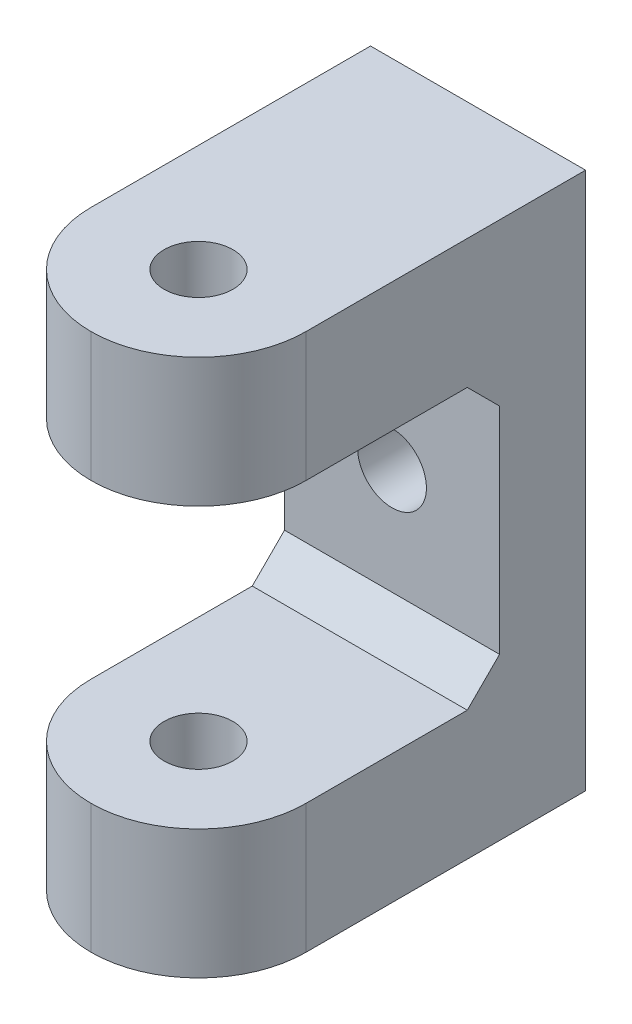
from build123d import *

# Parameters (mm, degrees)
SKETCH1_W                = 10
SKETCH1_H                = 6
BOSS_EXTRUDE1_DEPTH      = 15
BOSS_EXTRUDE1_2_DEPTH    = 15
FILLET1_R                = 5
FILLET2_R                = 5
BOSS_EXTRUDE2_DEPTH      = 3
BOSS_EXTRUDE2_DEPTH_BACK = 1
SKETCH2_W                = 10
SKETCH2_H                = 25
SKETCH3_R                = 1.6
CUT_EXTRUDE1_DEPTH       = 31.822070015
CUT_EXTRUDE2_REACH       = 34.388
SKETCH4_R                = 1.6
CHAMFER1_SIZE            = 1.5


with BuildPart() as part:
    # Sketch1 → Boss-Extrude1 (new body)
    with BuildSketch(Plane.XY):
        with Locations((5, 3)):
            Rectangle(SKETCH1_W, SKETCH1_H)
    extrude(amount=BOSS_EXTRUDE1_DEPTH)

    # Fillet2
    fillet2_edges = [part.edges().sort_by_distance(p)[0] for p in [
        (10, 3, 15),
        (0, 3, 15),
    ]]
    fillet(fillet2_edges, radius=FILLET2_R - 0.0001)  # a hair under: the kernel refuses the full size



with BuildPart() as body_2:
    # Sketch1 → Boss-Extrude1 2 (new body)
    with BuildSketch(Plane.XY):
        with Locations((5, 22)):
            Rectangle(SKETCH1_W, SKETCH1_H)
    extrude(amount=BOSS_EXTRUDE1_2_DEPTH)

    # Fillet1
    fillet1_edges = [body_2.edges().sort_by_distance(p)[0] for p in [
        (10, 22, 15),
        (0, 22, 15),
    ]]
    fillet(fillet1_edges, radius=FILLET1_R - 0.0001)  # a hair under: the kernel refuses the full size


with BuildPart() as part_1:
    add(part.part)

    add(body_2.part)  # Boss-Extrude2 merges body 2
    # Sketch2 → Boss-Extrude2 (add, two sides: drawn at the far end of the back side and taken through both)
    with BuildSketch(Plane(origin=(0, 0, 0), x_dir=(-1, 0, 0), z_dir=(0, 0, -1)).offset(-BOSS_EXTRUDE2_DEPTH_BACK)):
        with Locations((-5, 12.5)):
            Rectangle(SKETCH2_W, SKETCH2_H)
    extrude(amount=BOSS_EXTRUDE2_DEPTH + BOSS_EXTRUDE2_DEPTH_BACK)

    # Sketch3 → Cut-Extrude1 (cut, through all)
    with BuildSketch(Plane(origin=(0, 25, 0), x_dir=(1, 0, 0), z_dir=(0, 1, 0))):
        with Locations(Location((5, -10, 0), (0, 0, 270))):
            Circle(SKETCH3_R)
    extrude(amount=-CUT_EXTRUDE1_DEPTH, mode=Mode.SUBTRACT)

    # Sketch4 → Cut-Extrude2 (cut, up to next)
    with BuildSketch(Plane(origin=(0, 0, -3), x_dir=(-1, 0, 0), z_dir=(0, 0, -1)), mode=Mode.PRIVATE) as cut_extrude2_sk1:
        with Locations((-5, 12.5)):
            Circle(SKETCH4_R)
    cut_extrude2_tool1 = extrude(cut_extrude2_sk1.sketch, amount=-CUT_EXTRUDE2_REACH, mode=Mode.PRIVATE) & part_1.part
    add(cut_extrude2_tool1.solids().sort_by_distance((5, 12.5, -3))[0], mode=Mode.SUBTRACT)

    # Chamfer1
    chamfer1_edges = [part_1.edges().sort_by_distance(p)[0] for p in [
        (5, 6, 1),
        (5, 19, 1),
    ]]
    chamfer(chamfer1_edges, length=CHAMFER1_SIZE)


solid = part_1.part
